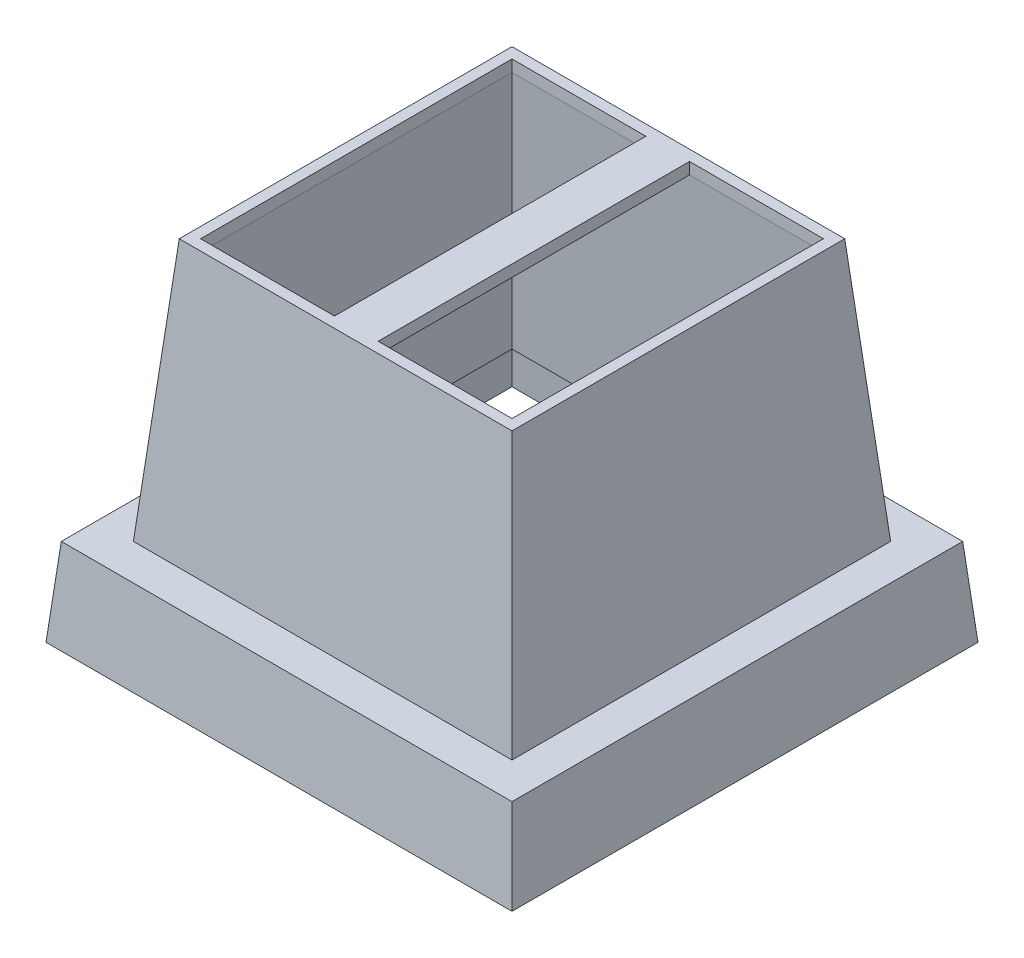
from build123d import *

# Parameters (mm, degrees)
SKETCH1_W           = 32
SKETCH1_H           = 32
BOSS_EXTRUDE1_DEPTH = 6
BOSS_EXTRUDE1_TAPER = 5
SKETCH2_W           = 26
SKETCH2_H           = 26
BOSS_EXTRUDE2_DEPTH = 18
BOSS_EXTRUDE2_TAPER = 5
SHELL1_T            = -0.8
CHAMFER1_SIZE       = 2.5
CHAMFER1_SIZE_2     = 2.750157169
SKETCH3_W           = 9.192139117
SKETCH3_H           = 21.384278234
CUT_EXTRUDE1_DEPTH  = 51.855088412


with BuildPart() as part:
    # Sketch1 → Boss-Extrude1 (new body)
    with BuildSketch(Plane(origin=(0, 0, 0), x_dir=(1, 0, 0), z_dir=(0, 1, 0))):
        with Locations((-16, 16)):
            Rectangle(SKETCH1_W, SKETCH1_H)
    extrude(amount=BOSS_EXTRUDE1_DEPTH, taper=BOSS_EXTRUDE1_TAPER)

    # Sketch2 → Boss-Extrude2 (add)
    with BuildSketch(Plane(origin=(0, 6, 0), x_dir=(1, 0, 0), z_dir=(0, 1, 0))):
        with Locations((-16, 16)):
            Rectangle(SKETCH2_W, SKETCH2_H)
    extrude(amount=BOSS_EXTRUDE2_DEPTH, taper=BOSS_EXTRUDE2_TAPER)

    # Shell1
    shell1_openings = [part.faces().sort_by_distance(p)[0] for p in [
        (-16, 0, -16),
    ]]
    offset(amount=SHELL1_T, openings=shell1_openings, kind=Kind.INTERSECTION)

    # Chamfer1
    # the kernel refuses this chamfer: 2.750157169, 2.5 mm, written as the material it adds along each edge
    with BuildSketch(Plane(origin=(5.830274952, 5.2, -1.25799692), x_dir=(0, 0.030161850139926293, -0.9995450278982617), z_dir=(-1, 0, 0))) as chamfer1_piece_1_section:
        Polygon((CHAMFER1_SIZE * 0.999545027898, CHAMFER1_SIZE * 0.0301618501399), (-CHAMFER1_SIZE_2 * 0.117163164513, CHAMFER1_SIZE_2 * 0.993112678869), (0, 0), align=None)
    chamfer1_piece_1 = extrude(amount=43.660549905, mode=Mode.PRIVATE)
    chamfer1_piece_1 = split(chamfer1_piece_1, bisect_by=Plane(origin=(-1.2737044, 5.379537315, -3.779154262), z_dir=(-0.9961946980917455, -0.08715574274765792, 0)), keep=Keep.TOP, mode=Mode.PRIVATE)
    chamfer1_piece_1 = split(chamfer1_piece_1, bisect_by=Plane(origin=(-3.729971497, 5.164641789, -3.779154262), z_dir=(0.9961946980917455, 0.08715574274765821, 0)), keep=Keep.TOP, mode=Mode.PRIVATE)
    chamfer1_piece_1 = split(chamfer1_piece_1, bisect_by=Plane(origin=(-2.501837948, 5.275543614, -3.739674149), z_dir=(0, -0.08715574274765829, -0.9961946980917455)), keep=Keep.TOP, mode=Mode.PRIVATE)
    add(chamfer1_piece_1)
    with BuildSketch(Plane(origin=(5.830274952, 5.2, -1.25799692), x_dir=(0, 0.030161850139926293, -0.9995450278982617), z_dir=(-1, 0, 0))) as chamfer1_piece_2_section:
        Polygon((CHAMFER1_SIZE * 0.999545027898, CHAMFER1_SIZE * 0.0301618501399), (-CHAMFER1_SIZE_2 * 0.117163164513, CHAMFER1_SIZE_2 * 0.993112678869), (0, 0), align=None)
    chamfer1_piece_2 = extrude(amount=43.660549905, mode=Mode.PRIVATE)
    chamfer1_piece_2 = split(chamfer1_piece_2, bisect_by=Plane(origin=(-1.187972058, 4.399612159, -1.99521412), z_dir=(-0.9961946980917455, -0.08715574274765792, 0)), keep=Keep.TOP, mode=Mode.PRIVATE)
    chamfer1_piece_2 = split(chamfer1_piece_2, bisect_by=Plane(origin=(-3.644239154, 4.184716633, -1.99521412), z_dir=(0.9961946980917455, 0.08715574274765821, 0)), keep=Keep.TOP, mode=Mode.PRIVATE)
    chamfer1_piece_2 = split(chamfer1_piece_2, bisect_by=Plane(origin=(-2.416105606, 4.148173113, -3.641042011), z_dir=(0, 0.08715574274765829, 0.9961946980917455)), keep=Keep.TOP, mode=Mode.PRIVATE)
    add(chamfer1_piece_2)
    with BuildSketch(Plane(origin=(5.830274952, 5.2, -1.25799692), x_dir=(0, 0.030161850139926293, -0.9995450278982617), z_dir=(-1, 0, 0))) as chamfer1_piece_3_section:
        Polygon((CHAMFER1_SIZE * 0.999545027898, CHAMFER1_SIZE * 0.0301618501399), (-CHAMFER1_SIZE_2 * 0.117163164513, CHAMFER1_SIZE_2 * 0.993112678869), (0, 0), align=None)
    chamfer1_piece_3 = extrude(amount=43.660549905, mode=Mode.PRIVATE)
    chamfer1_piece_3 = split(chamfer1_piece_3, bisect_by=Plane(origin=(-3.747130429, 5.360769289, -1.993289961), z_dir=(-0.9961946980917455, -0.08715574274765821, 0)), keep=Keep.TOP, mode=Mode.PRIVATE)
    chamfer1_piece_3 = split(chamfer1_piece_3, bisect_by=Plane(origin=(-16, 4.144649452, -3.64073373), z_dir=(0, 0.08715574274765829, 0.9961946980917455)), keep=Keep.TOP, mode=Mode.PRIVATE)
    chamfer1_piece_3 = split(chamfer1_piece_3, bisect_by=Plane(origin=(-28.252869571, 5.360769289, -1.993289961), z_dir=(0.9961946980917455, -0.08715574274765829, 0)), keep=Keep.TOP, mode=Mode.PRIVATE)
    add(chamfer1_piece_3)
    with BuildSketch(Plane(origin=(5.830274952, 5.2, -1.25799692), x_dir=(0, 0.030161850139926293, -0.9995450278982617), z_dir=(-1, 0, 0))) as chamfer1_piece_4_section:
        Polygon((CHAMFER1_SIZE * 0.999545027898, CHAMFER1_SIZE * 0.0301618501399), (-CHAMFER1_SIZE_2 * 0.117163164513, CHAMFER1_SIZE_2 * 0.993112678869), (0, 0), align=None)
    chamfer1_piece_4 = extrude(amount=43.660549905, mode=Mode.PRIVATE)
    chamfer1_piece_4 = split(chamfer1_piece_4, bisect_by=Plane(origin=(-29.498162052, 5.275543614, -3.739674149), z_dir=(0, -0.08715574274765829, -0.9961946980917455)), keep=Keep.TOP, mode=Mode.PRIVATE)
    chamfer1_piece_4 = split(chamfer1_piece_4, bisect_by=Plane(origin=(-28.270028503, 5.164641789, -3.779154262), z_dir=(-0.9961946980917455, 0.08715574274765829, 0)), keep=Keep.TOP, mode=Mode.PRIVATE)
    chamfer1_piece_4 = split(chamfer1_piece_4, bisect_by=Plane(origin=(-30.7262956, 5.379537315, -3.779154262), z_dir=(0.9961946980917455, -0.08715574274765851, 0)), keep=Keep.TOP, mode=Mode.PRIVATE)
    add(chamfer1_piece_4)
    with BuildSketch(Plane(origin=(5.830274952, 5.2, -1.25799692), x_dir=(0, 0.030161850139926293, -0.9995450278982617), z_dir=(-1, 0, 0))) as chamfer1_piece_5_section:
        Polygon((CHAMFER1_SIZE * 0.999545027898, CHAMFER1_SIZE * 0.0301618501399), (-CHAMFER1_SIZE_2 * 0.117163164513, CHAMFER1_SIZE_2 * 0.993112678869), (0, 0), align=None)
    chamfer1_piece_5 = extrude(amount=43.660549905, mode=Mode.PRIVATE)
    chamfer1_piece_5 = split(chamfer1_piece_5, bisect_by=Plane(origin=(-29.583894394, 4.148173113, -3.641042011), z_dir=(0, 0.08715574274765829, 0.9961946980917455)), keep=Keep.TOP, mode=Mode.PRIVATE)
    chamfer1_piece_5 = split(chamfer1_piece_5, bisect_by=Plane(origin=(-28.355760846, 4.184716633, -1.99521412), z_dir=(-0.9961946980917455, 0.08715574274765829, 0)), keep=Keep.TOP, mode=Mode.PRIVATE)
    chamfer1_piece_5 = split(chamfer1_piece_5, bisect_by=Plane(origin=(-30.812027942, 4.399612159, -1.99521412), z_dir=(0.9961946980917455, -0.08715574274765851, 0)), keep=Keep.TOP, mode=Mode.PRIVATE)
    add(chamfer1_piece_5)
    with BuildSketch(Plane(origin=(-30.74200308, 5.2, 5.830274952), x_dir=(0.9995450278982617, 0.030161850139926356, 0), z_dir=(0, 0, -1))) as chamfer1_piece_6_section:
        Polygon((CHAMFER1_SIZE * 0.999545027898, CHAMFER1_SIZE * 0.0301618501399), (-CHAMFER1_SIZE_2 * 0.117163164513, CHAMFER1_SIZE_2 * 0.993112678869), (0, 0), align=None)
    chamfer1_piece_6 = extrude(amount=43.660549905, mode=Mode.PRIVATE)
    chamfer1_piece_6 = split(chamfer1_piece_6, bisect_by=Plane(origin=(-28.220845738, 5.164641789, -3.729971497), z_dir=(0, 0.08715574274765829, 0.9961946980917455)), keep=Keep.TOP, mode=Mode.PRIVATE)
    chamfer1_piece_6 = split(chamfer1_piece_6, bisect_by=Plane(origin=(-28.260325851, 5.275543614, -2.501837948), z_dir=(0.9961946980917455, -0.08715574274765829, 0)), keep=Keep.TOP, mode=Mode.PRIVATE)
    chamfer1_piece_6 = split(chamfer1_piece_6, bisect_by=Plane(origin=(-28.220845738, 5.379537315, -1.2737044), z_dir=(0, -0.08715574274765792, -0.9961946980917455)), keep=Keep.TOP, mode=Mode.PRIVATE)
    add(chamfer1_piece_6)
    with BuildSketch(Plane(origin=(-30.74200308, 5.2, 5.830274952), x_dir=(0.9995450278982617, 0.030161850139926356, 0), z_dir=(0, 0, -1))) as chamfer1_piece_7_section:
        Polygon((CHAMFER1_SIZE * 0.999545027898, CHAMFER1_SIZE * 0.0301618501399), (-CHAMFER1_SIZE_2 * 0.117163164513, CHAMFER1_SIZE_2 * 0.993112678869), (0, 0), align=None)
    chamfer1_piece_7 = extrude(amount=43.660549905, mode=Mode.PRIVATE)
    chamfer1_piece_7 = split(chamfer1_piece_7, bisect_by=Plane(origin=(-30.00478588, 4.184716633, -3.644239154), z_dir=(0, 0.08715574274765829, 0.9961946980917455)), keep=Keep.TOP, mode=Mode.PRIVATE)
    chamfer1_piece_7 = split(chamfer1_piece_7, bisect_by=Plane(origin=(-28.358957989, 4.148173113, -2.416105606), z_dir=(-0.9961946980917455, 0.08715574274765829, 0)), keep=Keep.TOP, mode=Mode.PRIVATE)
    chamfer1_piece_7 = split(chamfer1_piece_7, bisect_by=Plane(origin=(-30.00478588, 4.399612159, -1.187972058), z_dir=(0, -0.08715574274765792, -0.9961946980917455)), keep=Keep.TOP, mode=Mode.PRIVATE)
    add(chamfer1_piece_7)
    with BuildSketch(Plane(origin=(-30.74200308, 5.2, 5.830274952), x_dir=(0.9995450278982617, 0.030161850139926356, 0), z_dir=(0, 0, -1))) as chamfer1_piece_8_section:
        Polygon((CHAMFER1_SIZE * 0.999545027898, CHAMFER1_SIZE * 0.0301618501399), (-CHAMFER1_SIZE_2 * 0.117163164513, CHAMFER1_SIZE_2 * 0.993112678869), (0, 0), align=None)
    chamfer1_piece_8 = extrude(amount=43.660549905, mode=Mode.PRIVATE)
    chamfer1_piece_8 = split(chamfer1_piece_8, bisect_by=Plane(origin=(-30.006710039, 5.360769289, -28.252869571), z_dir=(0, -0.08715574274765829, 0.9961946980917455)), keep=Keep.TOP, mode=Mode.PRIVATE)
    chamfer1_piece_8 = split(chamfer1_piece_8, bisect_by=Plane(origin=(-30.006710039, 5.360769289, -3.747130429), z_dir=(0, -0.08715574274765829, -0.9961946980917455)), keep=Keep.TOP, mode=Mode.PRIVATE)
    chamfer1_piece_8 = split(chamfer1_piece_8, bisect_by=Plane(origin=(-28.35926627, 4.144649452, -16), z_dir=(-0.9961946980917455, 0.08715574274765829, 0)), keep=Keep.TOP, mode=Mode.PRIVATE)
    add(chamfer1_piece_8)
    with BuildSketch(Plane(origin=(-30.74200308, 5.2, 5.830274952), x_dir=(0.9995450278982617, 0.030161850139926356, 0), z_dir=(0, 0, -1))) as chamfer1_piece_9_section:
        Polygon((CHAMFER1_SIZE * 0.999545027898, CHAMFER1_SIZE * 0.0301618501399), (-CHAMFER1_SIZE_2 * 0.117163164513, CHAMFER1_SIZE_2 * 0.993112678869), (0, 0), align=None)
    chamfer1_piece_9 = extrude(amount=43.660549905, mode=Mode.PRIVATE)
    chamfer1_piece_9 = split(chamfer1_piece_9, bisect_by=Plane(origin=(-28.220845738, 5.379537315, -30.7262956), z_dir=(0, -0.08715574274765836, 0.9961946980917455)), keep=Keep.TOP, mode=Mode.PRIVATE)
    chamfer1_piece_9 = split(chamfer1_piece_9, bisect_by=Plane(origin=(-28.220845738, 5.164641789, -28.270028503), z_dir=(0, 0.08715574274765829, -0.9961946980917455)), keep=Keep.TOP, mode=Mode.PRIVATE)
    chamfer1_piece_9 = split(chamfer1_piece_9, bisect_by=Plane(origin=(-28.260325851, 5.275543614, -29.498162052), z_dir=(0.9961946980917455, -0.08715574274765829, 0)), keep=Keep.TOP, mode=Mode.PRIVATE)
    add(chamfer1_piece_9)
    with BuildSketch(Plane(origin=(-30.74200308, 5.2, 5.830274952), x_dir=(0.9995450278982617, 0.030161850139926356, 0), z_dir=(0, 0, -1))) as chamfer1_piece_10_section:
        Polygon((CHAMFER1_SIZE * 0.999545027898, CHAMFER1_SIZE * 0.0301618501399), (-CHAMFER1_SIZE_2 * 0.117163164513, CHAMFER1_SIZE_2 * 0.993112678869), (0, 0), align=None)
    chamfer1_piece_10 = extrude(amount=43.660549905, mode=Mode.PRIVATE)
    chamfer1_piece_10 = split(chamfer1_piece_10, bisect_by=Plane(origin=(-30.00478588, 4.399612159, -30.812027942), z_dir=(0, -0.08715574274765836, 0.9961946980917455)), keep=Keep.TOP, mode=Mode.PRIVATE)
    chamfer1_piece_10 = split(chamfer1_piece_10, bisect_by=Plane(origin=(-30.00478588, 4.184716633, -28.355760846), z_dir=(0, 0.08715574274765829, -0.9961946980917455)), keep=Keep.TOP, mode=Mode.PRIVATE)
    chamfer1_piece_10 = split(chamfer1_piece_10, bisect_by=Plane(origin=(-28.358957989, 4.148173113, -29.583894394), z_dir=(-0.9961946980917455, 0.08715574274765829, 0)), keep=Keep.TOP, mode=Mode.PRIVATE)
    add(chamfer1_piece_10)
    with BuildSketch(Plane(origin=(5.830274952, 5.2, -30.74200308), x_dir=(0, -0.9937112432628153, -0.11197305485280758), z_dir=(-1, 0, 0))) as chamfer1_piece_11_section:
        Polygon((CHAMFER1_SIZE_2 * 0.99968896676, CHAMFER1_SIZE_2 * 0.0249393220908), (-CHAMFER1_SIZE * 0.111973054853, CHAMFER1_SIZE * 0.993711243263), (0, 0), align=None)
    chamfer1_piece_11 = extrude(amount=43.660549905, mode=Mode.PRIVATE)
    chamfer1_piece_11 = split(chamfer1_piece_11, bisect_by=Plane(origin=(-1.187972058, 4.399612159, -30.00478588), z_dir=(-0.9961946980917455, -0.08715574274765792, 0)), keep=Keep.TOP, mode=Mode.PRIVATE)
    chamfer1_piece_11 = split(chamfer1_piece_11, bisect_by=Plane(origin=(-2.416105606, 4.148173113, -28.358957989), z_dir=(0, 0.08715574274765829, -0.9961946980917455)), keep=Keep.TOP, mode=Mode.PRIVATE)
    chamfer1_piece_11 = split(chamfer1_piece_11, bisect_by=Plane(origin=(-3.644239154, 4.184716633, -30.00478588), z_dir=(0.9961946980917455, 0.08715574274765821, 0)), keep=Keep.TOP, mode=Mode.PRIVATE)
    add(chamfer1_piece_11)
    with BuildSketch(Plane(origin=(5.830274952, 5.2, -30.74200308), x_dir=(0, -0.9937112432628153, -0.11197305485280758), z_dir=(-1, 0, 0))) as chamfer1_piece_12_section:
        Polygon((CHAMFER1_SIZE_2 * 0.99968896676, CHAMFER1_SIZE_2 * 0.0249393220908), (-CHAMFER1_SIZE * 0.111973054853, CHAMFER1_SIZE * 0.993711243263), (0, 0), align=None)
    chamfer1_piece_12 = extrude(amount=43.660549905, mode=Mode.PRIVATE)
    chamfer1_piece_12 = split(chamfer1_piece_12, bisect_by=Plane(origin=(-1.2737044, 5.379537315, -28.220845738), z_dir=(-0.9961946980917455, -0.08715574274765792, 0)), keep=Keep.TOP, mode=Mode.PRIVATE)
    chamfer1_piece_12 = split(chamfer1_piece_12, bisect_by=Plane(origin=(-2.501837948, 5.275543614, -28.260325851), z_dir=(0, -0.08715574274765829, 0.9961946980917455)), keep=Keep.TOP, mode=Mode.PRIVATE)
    chamfer1_piece_12 = split(chamfer1_piece_12, bisect_by=Plane(origin=(-3.729971497, 5.164641789, -28.220845738), z_dir=(0.9961946980917455, 0.08715574274765821, 0)), keep=Keep.TOP, mode=Mode.PRIVATE)
    add(chamfer1_piece_12)
    with BuildSketch(Plane(origin=(5.830274952, 5.2, -30.74200308), x_dir=(0, -0.9937112432628153, -0.11197305485280758), z_dir=(-1, 0, 0))) as chamfer1_piece_13_section:
        Polygon((CHAMFER1_SIZE_2 * 0.99968896676, CHAMFER1_SIZE_2 * 0.0249393220908), (-CHAMFER1_SIZE * 0.111973054853, CHAMFER1_SIZE * 0.993711243263), (0, 0), align=None)
    chamfer1_piece_13 = extrude(amount=43.660549905, mode=Mode.PRIVATE)
    chamfer1_piece_13 = split(chamfer1_piece_13, bisect_by=Plane(origin=(-16, 4.144649452, -28.35926627), z_dir=(0, 0.08715574274765829, -0.9961946980917455)), keep=Keep.TOP, mode=Mode.PRIVATE)
    chamfer1_piece_13 = split(chamfer1_piece_13, bisect_by=Plane(origin=(-3.747130429, 5.360769289, -30.006710039), z_dir=(-0.9961946980917455, -0.08715574274765821, 0)), keep=Keep.TOP, mode=Mode.PRIVATE)
    chamfer1_piece_13 = split(chamfer1_piece_13, bisect_by=Plane(origin=(-28.252869571, 5.360769289, -30.006710039), z_dir=(0.9961946980917455, -0.08715574274765829, 0)), keep=Keep.TOP, mode=Mode.PRIVATE)
    add(chamfer1_piece_13)
    with BuildSketch(Plane(origin=(5.830274952, 5.2, -30.74200308), x_dir=(0, -0.9937112432628153, -0.11197305485280758), z_dir=(-1, 0, 0))) as chamfer1_piece_14_section:
        Polygon((CHAMFER1_SIZE_2 * 0.99968896676, CHAMFER1_SIZE_2 * 0.0249393220908), (-CHAMFER1_SIZE * 0.111973054853, CHAMFER1_SIZE * 0.993711243263), (0, 0), align=None)
    chamfer1_piece_14 = extrude(amount=43.660549905, mode=Mode.PRIVATE)
    chamfer1_piece_14 = split(chamfer1_piece_14, bisect_by=Plane(origin=(-30.812027942, 4.399612159, -30.00478588), z_dir=(0.9961946980917455, -0.08715574274765851, 0)), keep=Keep.TOP, mode=Mode.PRIVATE)
    chamfer1_piece_14 = split(chamfer1_piece_14, bisect_by=Plane(origin=(-29.583894394, 4.148173113, -28.358957989), z_dir=(0, 0.08715574274765829, -0.9961946980917455)), keep=Keep.TOP, mode=Mode.PRIVATE)
    chamfer1_piece_14 = split(chamfer1_piece_14, bisect_by=Plane(origin=(-28.355760846, 4.184716633, -30.00478588), z_dir=(-0.9961946980917455, 0.08715574274765829, 0)), keep=Keep.TOP, mode=Mode.PRIVATE)
    add(chamfer1_piece_14)
    with BuildSketch(Plane(origin=(5.830274952, 5.2, -30.74200308), x_dir=(0, -0.9937112432628153, -0.11197305485280758), z_dir=(-1, 0, 0))) as chamfer1_piece_15_section:
        Polygon((CHAMFER1_SIZE_2 * 0.99968896676, CHAMFER1_SIZE_2 * 0.0249393220908), (-CHAMFER1_SIZE * 0.111973054853, CHAMFER1_SIZE * 0.993711243263), (0, 0), align=None)
    chamfer1_piece_15 = extrude(amount=43.660549905, mode=Mode.PRIVATE)
    chamfer1_piece_15 = split(chamfer1_piece_15, bisect_by=Plane(origin=(-30.7262956, 5.379537315, -28.220845738), z_dir=(0.9961946980917455, -0.08715574274765851, 0)), keep=Keep.TOP, mode=Mode.PRIVATE)
    chamfer1_piece_15 = split(chamfer1_piece_15, bisect_by=Plane(origin=(-29.498162052, 5.275543614, -28.260325851), z_dir=(0, -0.08715574274765829, 0.9961946980917455)), keep=Keep.TOP, mode=Mode.PRIVATE)
    chamfer1_piece_15 = split(chamfer1_piece_15, bisect_by=Plane(origin=(-28.270028503, 5.164641789, -28.220845738), z_dir=(-0.9961946980917455, 0.08715574274765829, 0)), keep=Keep.TOP, mode=Mode.PRIVATE)
    add(chamfer1_piece_15)
    with BuildSketch(Plane(origin=(-1.25799692, 5.2, 5.830274952), x_dir=(0.11197305485280797, -0.9937112432628151, 0), z_dir=(0, 0, -1))) as chamfer1_piece_16_section:
        Polygon((CHAMFER1_SIZE_2 * 0.99968896676, CHAMFER1_SIZE_2 * 0.0249393220908), (-CHAMFER1_SIZE * 0.111973054853, CHAMFER1_SIZE * 0.993711243263), (0, 0), align=None)
    chamfer1_piece_16 = extrude(amount=43.660549905, mode=Mode.PRIVATE)
    chamfer1_piece_16 = split(chamfer1_piece_16, bisect_by=Plane(origin=(-1.99521412, 4.399612159, -1.187972058), z_dir=(0, -0.08715574274765792, -0.9961946980917455)), keep=Keep.TOP, mode=Mode.PRIVATE)
    chamfer1_piece_16 = split(chamfer1_piece_16, bisect_by=Plane(origin=(-3.641042011, 4.148173113, -2.416105606), z_dir=(0.9961946980917455, 0.08715574274765821, 0)), keep=Keep.TOP, mode=Mode.PRIVATE)
    chamfer1_piece_16 = split(chamfer1_piece_16, bisect_by=Plane(origin=(-1.99521412, 4.184716633, -3.644239154), z_dir=(0, 0.08715574274765829, 0.9961946980917455)), keep=Keep.TOP, mode=Mode.PRIVATE)
    add(chamfer1_piece_16)
    with BuildSketch(Plane(origin=(-1.25799692, 5.2, 5.830274952), x_dir=(0.11197305485280797, -0.9937112432628151, 0), z_dir=(0, 0, -1))) as chamfer1_piece_17_section:
        Polygon((CHAMFER1_SIZE_2 * 0.99968896676, CHAMFER1_SIZE_2 * 0.0249393220908), (-CHAMFER1_SIZE * 0.111973054853, CHAMFER1_SIZE * 0.993711243263), (0, 0), align=None)
    chamfer1_piece_17 = extrude(amount=43.660549905, mode=Mode.PRIVATE)
    chamfer1_piece_17 = split(chamfer1_piece_17, bisect_by=Plane(origin=(-3.779154262, 5.379537315, -1.2737044), z_dir=(0, -0.08715574274765792, -0.9961946980917455)), keep=Keep.TOP, mode=Mode.PRIVATE)
    chamfer1_piece_17 = split(chamfer1_piece_17, bisect_by=Plane(origin=(-3.739674149, 5.275543614, -2.501837948), z_dir=(-0.9961946980917455, -0.08715574274765821, 0)), keep=Keep.TOP, mode=Mode.PRIVATE)
    chamfer1_piece_17 = split(chamfer1_piece_17, bisect_by=Plane(origin=(-3.779154262, 5.164641789, -3.729971497), z_dir=(0, 0.08715574274765829, 0.9961946980917455)), keep=Keep.TOP, mode=Mode.PRIVATE)
    add(chamfer1_piece_17)
    with BuildSketch(Plane(origin=(-1.25799692, 5.2, 5.830274952), x_dir=(0.11197305485280797, -0.9937112432628151, 0), z_dir=(0, 0, -1))) as chamfer1_piece_18_section:
        Polygon((CHAMFER1_SIZE_2 * 0.99968896676, CHAMFER1_SIZE_2 * 0.0249393220908), (-CHAMFER1_SIZE * 0.111973054853, CHAMFER1_SIZE * 0.993711243263), (0, 0), align=None)
    chamfer1_piece_18 = extrude(amount=43.660549905, mode=Mode.PRIVATE)
    chamfer1_piece_18 = split(chamfer1_piece_18, bisect_by=Plane(origin=(-1.993289961, 5.360769289, -28.252869571), z_dir=(0, -0.08715574274765829, 0.9961946980917455)), keep=Keep.TOP, mode=Mode.PRIVATE)
    chamfer1_piece_18 = split(chamfer1_piece_18, bisect_by=Plane(origin=(-3.64073373, 4.144649452, -16), z_dir=(0.9961946980917455, 0.08715574274765821, 0)), keep=Keep.TOP, mode=Mode.PRIVATE)
    chamfer1_piece_18 = split(chamfer1_piece_18, bisect_by=Plane(origin=(-1.993289961, 5.360769289, -3.747130429), z_dir=(0, -0.08715574274765829, -0.9961946980917455)), keep=Keep.TOP, mode=Mode.PRIVATE)
    add(chamfer1_piece_18)
    with BuildSketch(Plane(origin=(-1.25799692, 5.2, 5.830274952), x_dir=(0.11197305485280797, -0.9937112432628151, 0), z_dir=(0, 0, -1))) as chamfer1_piece_19_section:
        Polygon((CHAMFER1_SIZE_2 * 0.99968896676, CHAMFER1_SIZE_2 * 0.0249393220908), (-CHAMFER1_SIZE * 0.111973054853, CHAMFER1_SIZE * 0.993711243263), (0, 0), align=None)
    chamfer1_piece_19 = extrude(amount=43.660549905, mode=Mode.PRIVATE)
    chamfer1_piece_19 = split(chamfer1_piece_19, bisect_by=Plane(origin=(-1.99521412, 4.399612159, -30.812027942), z_dir=(0, -0.08715574274765836, 0.9961946980917455)), keep=Keep.TOP, mode=Mode.PRIVATE)
    chamfer1_piece_19 = split(chamfer1_piece_19, bisect_by=Plane(origin=(-1.99521412, 4.184716633, -28.355760846), z_dir=(0, 0.08715574274765829, -0.9961946980917455)), keep=Keep.TOP, mode=Mode.PRIVATE)
    chamfer1_piece_19 = split(chamfer1_piece_19, bisect_by=Plane(origin=(-3.641042011, 4.148173113, -29.583894394), z_dir=(0.9961946980917455, 0.08715574274765821, 0)), keep=Keep.TOP, mode=Mode.PRIVATE)
    add(chamfer1_piece_19)
    with BuildSketch(Plane(origin=(-1.25799692, 5.2, 5.830274952), x_dir=(0.11197305485280797, -0.9937112432628151, 0), z_dir=(0, 0, -1))) as chamfer1_piece_20_section:
        Polygon((CHAMFER1_SIZE_2 * 0.99968896676, CHAMFER1_SIZE_2 * 0.0249393220908), (-CHAMFER1_SIZE * 0.111973054853, CHAMFER1_SIZE * 0.993711243263), (0, 0), align=None)
    chamfer1_piece_20 = extrude(amount=43.660549905, mode=Mode.PRIVATE)
    chamfer1_piece_20 = split(chamfer1_piece_20, bisect_by=Plane(origin=(-3.779154262, 5.379537315, -30.7262956), z_dir=(0, -0.08715574274765836, 0.9961946980917455)), keep=Keep.TOP, mode=Mode.PRIVATE)
    chamfer1_piece_20 = split(chamfer1_piece_20, bisect_by=Plane(origin=(-3.779154262, 5.164641789, -28.270028503), z_dir=(0, 0.08715574274765829, -0.9961946980917455)), keep=Keep.TOP, mode=Mode.PRIVATE)
    chamfer1_piece_20 = split(chamfer1_piece_20, bisect_by=Plane(origin=(-3.739674149, 5.275543614, -29.498162052), z_dir=(-0.9961946980917455, -0.08715574274765821, 0)), keep=Keep.TOP, mode=Mode.PRIVATE)
    add(chamfer1_piece_20)

    # Sketch3 → Cut-Extrude1 (cut, through all)
    with BuildSketch(Plane.XZ.offset(-23.2)):
        with Locations((-22.096069558, -16)):
            Rectangle(SKETCH3_W, SKETCH3_H)
        with Locations((-9.903930442, -16)):
            Rectangle(SKETCH3_W, SKETCH3_H)
    extrude(amount=-CUT_EXTRUDE1_DEPTH, mode=Mode.SUBTRACT)


solid = part.part
